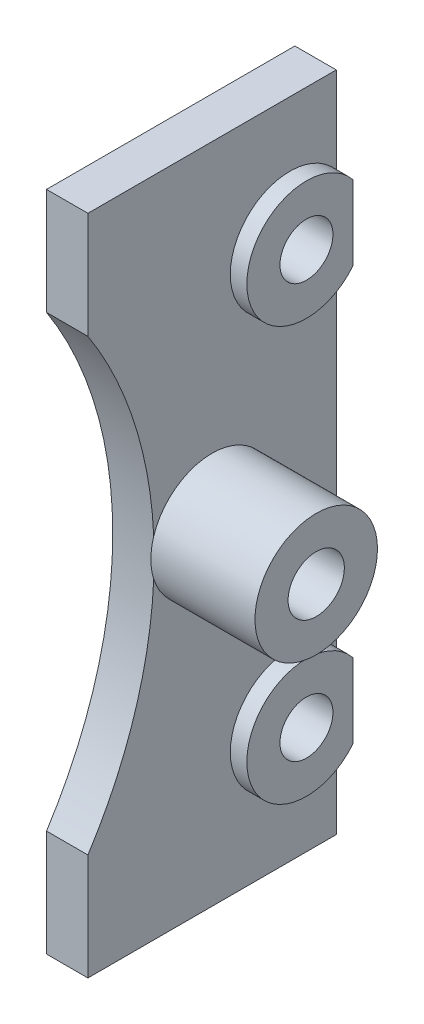
from build123d import *
from build123d.topology import SkipClean

# Parameters (mm, degrees)
SKETCH1_R           = 1.6
BOSS_EXTRUDE1_DEPTH = 2.5
BOSS_EXTRUDE2_START = -2.5
SKETCH1_3_W         = 15
SKETCH1_3_H         = 40
SKETCH1_3_R         = 1.7
SKETCH1_3_R_2       = 1.6
BOSS_EXTRUDE2_DEPTH = 2.5
SKETCH3_R           = 3.7
SKETCH3_R_2         = 1.7
EXTRUDE_THIN2_DEPTH = 6.29
SKETCH4_W           = 15
SKETCH4_H           = 40
CUT_EXTRUDE1_DEPTH  = 2.5
CUT_EXTRUDE2_DEPTH  = 2.5
SKETCH2_R           = 1.6
BOSS_EXTRUDE3_DEPTH = 1


with BuildPart() as part:
    # Sketch1 → Boss-Extrude1 (new body)
    # profile 1 of 8: a face of its own
    with BuildSketch(Plane(origin=(0, 0, 0), x_dir=(0, 0, -1), z_dir=(1, 0, 0))):
        with BuildLine():
            Line((7.5, 21.7), (7.5, 40))
            Line((7.5, 40), (0, 40))
            Line((0, 40), (0, 0))
            Line((0, 0), (7.5, 0))
            Line((7.5, 0), (7.5, 6.4))
            ThreePointArc((7.5, 6.4), (5.9, 8), (7.5, 9.6))
            Line((7.5, 9.6), (7.5, 18.3))
            ThreePointArc((7.5, 18.3), (5.8, 20), (7.5, 21.7))
        make_face()
    # profile 2 of 8: a face of its own
    with BuildSketch(Plane(origin=(0, 0, 0), x_dir=(0, 0, -1), z_dir=(1, 0, 0))):
        with BuildLine():
            Line((15, 40), (7.5, 40))
            Line((7.5, 40), (7.5, 21.7))
            ThreePointArc((7.5, 21.7), (8.702081528, 21.202081528), (9.2, 20))
            ThreePointArc((9.2, 20), (8.702081528, 18.797918472), (7.5, 18.3))
            Line((7.5, 18.3), (7.5, 9.6))
            ThreePointArc((7.5, 9.6), (8.63137085, 9.13137085), (9.1, 8))
            ThreePointArc((9.1, 8), (8.63137085, 6.86862915), (7.5, 6.4))
            Line((7.5, 6.4), (7.5, 0))
            Line((7.5, 0), (15, 0))
            Line((15, 0), (15, 5.883419246))
            Line((15, 5.883419246), (12.2, 4.266838493))
            Line((12.2, 4.266838493), (9.4, 5.883419246))
            Line((9.4, 5.883419246), (9.4, 9.116580754))
            Line((9.4, 9.116580754), (12.2, 10.733161507))
            Line((12.2, 10.733161507), (15, 9.116580754))
            Line((15, 9.116580754), (15, 30.883419246))
            Line((15, 30.883419246), (12.2, 29.266838493))
            Line((12.2, 29.266838493), (9.4, 30.883419246))
            Line((9.4, 30.883419246), (9.4, 34.116580754))
            Line((9.4, 34.116580754), (12.2, 35.733161507))
            Line((12.2, 35.733161507), (15, 34.116580754))
            Line((15, 34.116580754), (15, 40))
        make_face()
    # profile 3 of 8: a face of its own
    with BuildSketch(Plane(origin=(0, 0, 0), x_dir=(0, 0, -1), z_dir=(1, 0, 0))):
        with BuildLine():
            ThreePointArc((9.1, 8), (8.63137085, 9.13137085), (7.5, 9.6))
            Line((7.5, 9.6), (7.5, 6.4))
            ThreePointArc((7.5, 6.4), (8.63137085, 6.86862915), (9.1, 8))
        make_face()
    # profile 4 of 8: a face of its own
    with BuildSketch(Plane(origin=(0, 0, 0), x_dir=(0, 0, -1), z_dir=(1, 0, 0))):
        with BuildLine():
            Line((7.5, 6.4), (7.5, 9.6))
            ThreePointArc((7.5, 9.6), (5.9, 8), (7.5, 6.4))
        make_face()
    # profile 5 of 8: a face of its own
    with BuildSketch(Plane(origin=(0, 0, 0), x_dir=(0, 0, -1), z_dir=(1, 0, 0))):
        with BuildLine():
            ThreePointArc((9.1, 8), (8.63137085, 9.13137085), (7.5, 9.6))
            Line((7.5, 9.6), (7.5, 6.4))
            ThreePointArc((7.5, 6.4), (8.63137085, 6.86862915), (9.1, 8))
        make_face()
    # profile 6 of 8: a face of its own
    with BuildSketch(Plane(origin=(0, 0, 0), x_dir=(0, 0, -1), z_dir=(1, 0, 0))):
        with BuildLine():
            Line((7.5, 6.4), (7.5, 9.6))
            ThreePointArc((7.5, 9.6), (5.9, 8), (7.5, 6.4))
        make_face()
    # profile 7 of 8: a face of its own
    with BuildSketch(Plane(origin=(0, 0, 0), x_dir=(0, 0, -1), z_dir=(1, 0, 0))):
        Polygon((15, 5.883419246), (15, 9.116580754), (12.2, 10.733161507), (9.4, 9.116580754), (9.4, 5.883419246), (12.2, 4.266838493), align=None)
        with Locations((12.2, 7.5)):
            Circle(SKETCH1_R, mode=Mode.SUBTRACT)
    # profile 8 of 8: a face of its own
    with BuildSketch(Plane(origin=(0, 0, 0), x_dir=(0, 0, -1), z_dir=(1, 0, 0))):
        Polygon((15, 30.883419246), (15, 34.116580754), (12.2, 35.733161507), (9.4, 34.116580754), (9.4, 30.883419246), (12.2, 29.266838493), align=None)
        with Locations((12.2, 32.5)):
            Circle(SKETCH1_R, mode=Mode.SUBTRACT)
    extrude(amount=BOSS_EXTRUDE1_DEPTH)

    # Sketch1<3> → Boss-Extrude2 (add)
    with SkipClean():  # the faces are left unmerged after this step: merging them gives an invalid solid
        with BuildSketch(Plane(origin=(0, 0, 0), x_dir=(0, 0, -1), z_dir=(1, 0, 0)).offset(BOSS_EXTRUDE2_START)):
            with Locations((7.5, 20)):
                Rectangle(SKETCH1_3_W, SKETCH1_3_H)
            with Locations((7.5, 20)):
                Circle(SKETCH1_3_R, mode=Mode.SUBTRACT)
            with Locations((12.2, 32.5)):
                Circle(SKETCH1_3_R_2, mode=Mode.SUBTRACT)
            with Locations((12.2, 7.5)):
                Circle(SKETCH1_3_R_2, mode=Mode.SUBTRACT)
        extrude(amount=BOSS_EXTRUDE2_DEPTH)


with BuildPart() as part_1:
    # Body-Move/Copy1: moved
    add(part.part.moved(Location((-5, 0, 0))))

    # Sketch3 → Extrude-Thin2 (add)
    with SkipClean():  # the faces are left unmerged after this step: merging them gives an invalid solid
        with BuildSketch(Plane(origin=(-2.5, 0, 0), x_dir=(0, 0, -1), z_dir=(1, 0, 0))):
            with Locations((7.5, 20)):
                Circle(SKETCH3_R)
            with Locations((7.5, 20)):
                Circle(SKETCH3_R_2, mode=Mode.SUBTRACT)
        extrude(amount=EXTRUDE_THIN2_DEPTH)
    add(part_1.part.scale(1), mode=Mode.REPLACE)  # the faces are merged on a copy

    # Sketch4 → Cut-Extrude1 (cut)
    with BuildSketch(Plane.ZY.offset(7.5)):
        with Locations((-7.5, 20)):
            Rectangle(SKETCH4_W, SKETCH4_H)
    extrude(amount=-CUT_EXTRUDE1_DEPTH, mode=Mode.SUBTRACT)

    # Sketch5 → Cut-Extrude2 (cut)
    with BuildSketch(Plane.ZY.offset(5)):
        with BuildLine():
            ThreePointArc((0, 33.564659966), (-2.979157617, 27.071067812), (-4, 20))
            Line((-4, 20), (0, 20))
            Line((0, 20), (0, 33.564659966))
        make_face()
        with BuildLine():
            Line((0, 20), (-4, 20))
            ThreePointArc((-4, 20), (-2.979157617, 12.928932188), (0, 6.435340034))
            Line((0, 6.435340034), (0, 20))
        make_face()
        with BuildLine():
            Line((0, 33.564659966), (0, 20))
            Line((0, 20), (0, 6.435340034))
            ThreePointArc((0, 6.435340034), (28.071067812, -3.979157617), (46, 20))
            ThreePointArc((46, 20), (28.071067812, 43.979157617), (0, 33.564659966))
        make_face()
    extrude(amount=-CUT_EXTRUDE2_DEPTH, mode=Mode.SUBTRACT)

    # Sketch2 → Boss-Extrude3 (add)
    # profile 1 of 2: a face of its own
    with BuildSketch(Plane.ZY.offset(2.5)):
        with BuildLine():
            Line((-15, 9.7627417), (-15, 5.2372583))
            ThreePointArc((-15, 5.2372583), (-11, 4.10588745), (-8.6, 7.5))
            ThreePointArc((-8.6, 7.5), (-11, 10.89411255), (-15, 9.7627417))
        make_face()
        with Locations((-12.2, 7.5)):
            Circle(SKETCH2_R, mode=Mode.SUBTRACT)
    # profile 2 of 2: a face of its own
    with BuildSketch(Plane.ZY.offset(2.5)):
        with BuildLine():
            Line((-15, 34.7627417), (-15, 30.2372583))
            ThreePointArc((-15, 30.2372583), (-11, 29.10588745), (-8.6, 32.5))
            ThreePointArc((-8.6, 32.5), (-11, 35.89411255), (-15, 34.7627417))
        make_face()
        with Locations((-12.2, 32.5)):
            Circle(SKETCH2_R, mode=Mode.SUBTRACT)
    extrude(amount=-BOSS_EXTRUDE3_DEPTH)


solid = part_1.part
